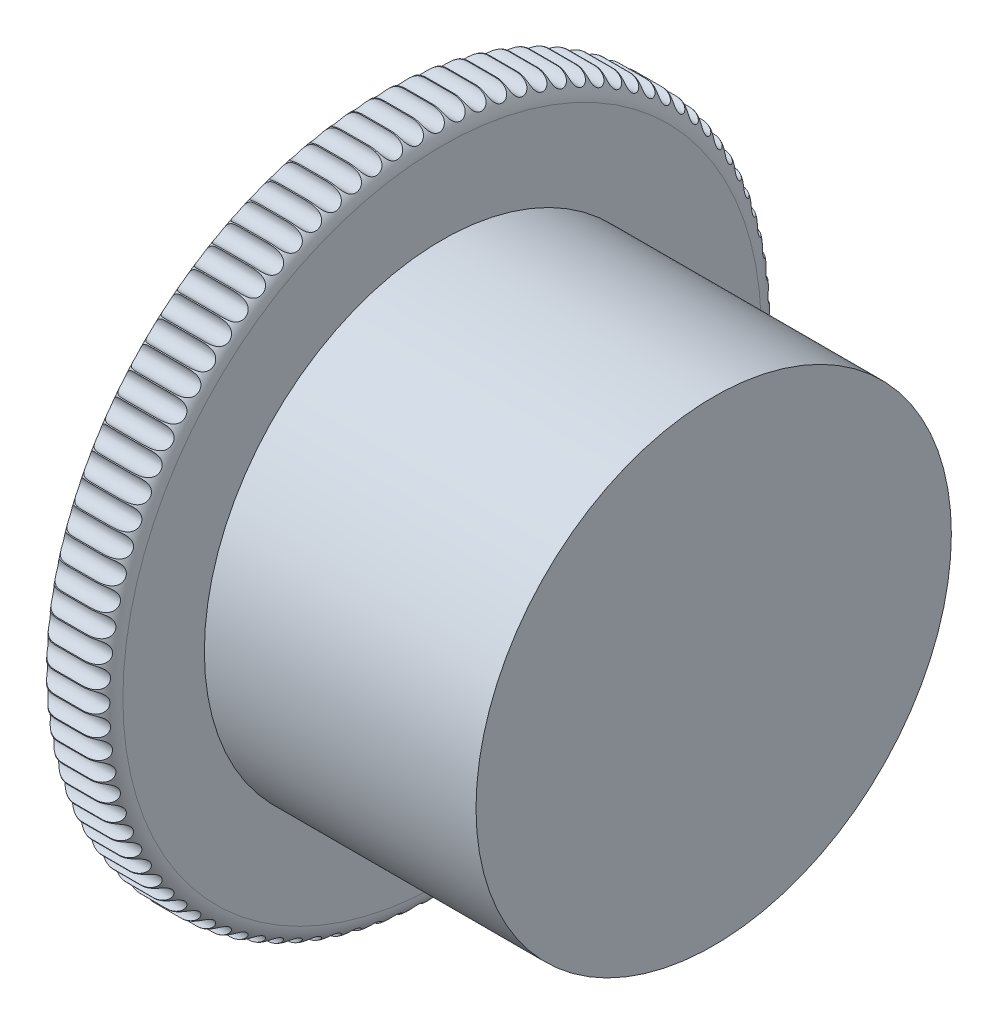
from build123d import *

# Parameters (mm, degrees)
SKETCH_2_R               = 1.5
CUT_EXTRUDE_1_DEPTH      = 10
PATTERN_CIRCULAR_1_COUNT = 100
CUT_EXTRUDE_2_DEPTH      = 5


with BuildPart() as part:
    # Эскиз1 → Повернуть1 (revolve)
    with BuildSketch(Plane.XY, mode=Mode.PRIVATE) as revolve_1_sk:
        with BuildLine():
            Line((0, 0), (0, 47))
            ThreePointArc((0, 47), (0.878679656, 49.121320344), (3, 50))
            Line((3, 50), (7, 50))
            ThreePointArc((7, 50), (9.121320344, 49.121320344), (10, 47))
            Line((10, 47), (10, 35))
            Line((10, 35), (50, 35))
            Line((50, 35), (50, 0))
            Line((50, 0), (0, 0))
        make_face()
    revolve(revolve_1_sk.sketch.rotate(Axis((-62.846347607, 0, 0), (1, 0, 0)), 90), axis=Axis((-62.846347607, 0, 0), (1, 0, 0)))

    # Эскиз2 → Вырез-Вытянуть1 (cut)
    with BuildSketch(Plane.ZY):
        with Locations((0, 50)):
            Circle(SKETCH_2_R)
    cut_extrude_1 = extrude(amount=-CUT_EXTRUDE_1_DEPTH, mode=Mode.SUBTRACT)

    # Круговой массив1: Вырез-Вытянуть1 ×100 about axis
    pattern_circular_1_axis = Axis((0, 0, 0), (1, 0, 0))
    for i in range(1, PATTERN_CIRCULAR_1_COUNT):
        add(cut_extrude_1.rotate(pattern_circular_1_axis, i * 360 / PATTERN_CIRCULAR_1_COUNT), mode=Mode.SUBTRACT)

    # Эскиз3 → Вырез-Вытянуть2 (cut, symmetric)
    with BuildSketch(Plane.XY):
        with BuildLine():
            Line((0, -35), (0, 35))
            ThreePointArc((0, 35), (9.025715901, 0), (0, -35))
        make_face()
    extrude(amount=CUT_EXTRUDE_2_DEPTH, both=True, mode=Mode.SUBTRACT)


solid = part.part
